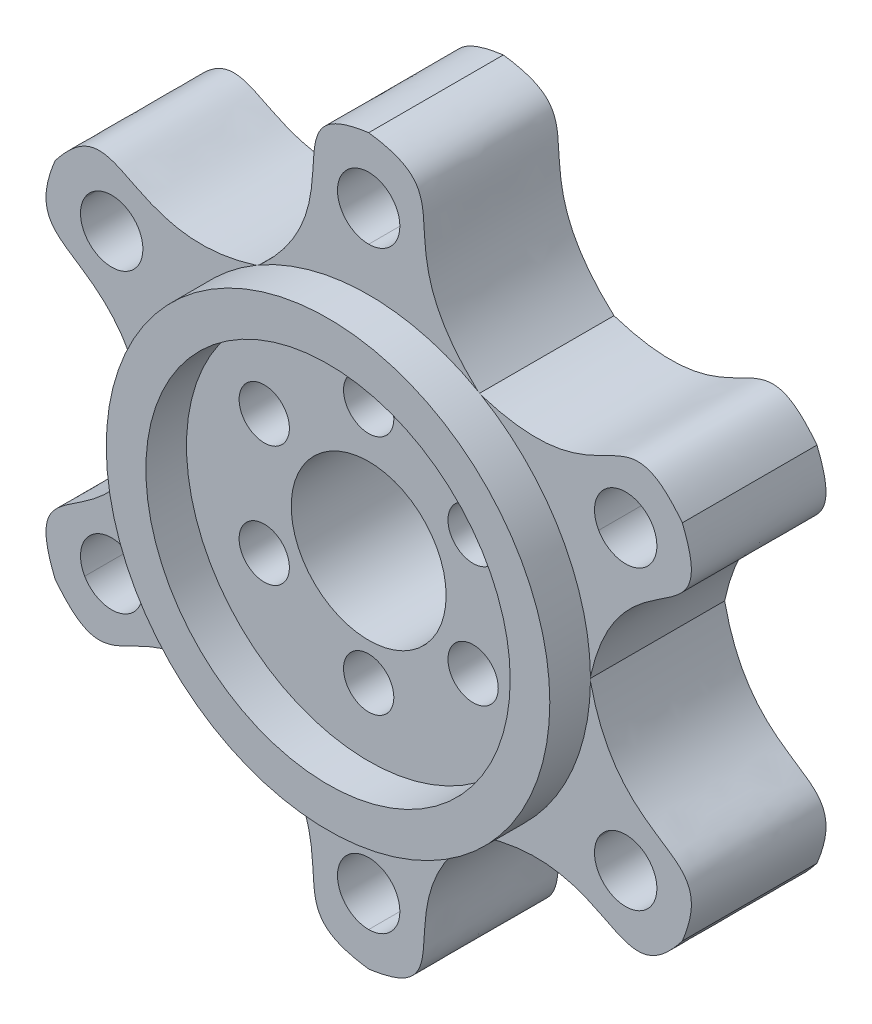
from build123d import *

# Parameters (mm, degrees)
SKETCH1_R           = 45.72
SKETCH1_R_2         = 9.779
SKETCH1_R_3         = 3.175
SKETCH1_R_4         = 3.937
BOSS_EXTRUDE3_DEPTH = 17.000000036
CUT_EXTRUDE1_START  = -22.86
CUT_EXTRUDE1_DEPTH  = 22.86
SKETCH4_R           = 28
SKETCH4_R_2         = 23
BOSS_EXTRUDE4_DEPTH = 5.1308


with BuildPart() as part:
    # Sketch1 → Boss-Extrude3 (new body)
    with BuildSketch(Plane.XY):
        Circle(SKETCH1_R)
        Circle(SKETCH1_R_2, mode=Mode.SUBTRACT)
        with Locations((0, 16.002)):
            Circle(SKETCH1_R_3, mode=Mode.SUBTRACT)
        with Locations((13.184862266, 8.389716222)):
            Circle(SKETCH1_R_3, mode=Mode.SUBTRACT)
        with Locations((13.184862266, -6.834851335)):
            Circle(SKETCH1_R_3, mode=Mode.SUBTRACT)
        with Locations((0, -14.447135113)):
            Circle(SKETCH1_R_3, mode=Mode.SUBTRACT)
        with Locations((-13.184862266, -6.834851335)):
            Circle(SKETCH1_R_3, mode=Mode.SUBTRACT)
        with Locations((-13.184862266, 8.389716222)):
            Circle(SKETCH1_R_3, mode=Mode.SUBTRACT)
        with Locations((0, 37.465)):
            Circle(SKETCH1_R_4, mode=Mode.SUBTRACT)
        with Locations((32.445641753, 18.7325)):
            Circle(SKETCH1_R_4, mode=Mode.SUBTRACT)
        with Locations((32.445641753, -18.7325)):
            Circle(SKETCH1_R_4, mode=Mode.SUBTRACT)
        with Locations((0, -37.465)):
            Circle(SKETCH1_R_4, mode=Mode.SUBTRACT)
        with Locations((-32.445641753, -18.7325)):
            Circle(SKETCH1_R_4, mode=Mode.SUBTRACT)
        with Locations((-32.445641753, 18.7325)):
            Circle(SKETCH1_R_4, mode=Mode.SUBTRACT)
    extrude(amount=BOSS_EXTRUDE3_DEPTH)

    # Sketch2 → Cut-Extrude1 (cut)
    with BuildSketch(Plane.XY.offset(17.000000036).offset(CUT_EXTRUDE1_START)):
        with BuildLine():
            ThreePointArc((39.594681461, -22.86), (45.72, 0), (39.594681461, 22.86))
            add(Edge.make_bspline(
                [(27.94, 0), (31.622092251, 17.195322725), (44.628878831, 10.61767176), (39.594681461, 22.86)],
                knots=[0, 0, 0, 0, 1, 1, 1, 1], degree=3))
            add(Edge.make_bspline(
                [(27.94, 0), (31.622092251, -17.195322725), (44.628878831, -10.61767176), (39.594681461, -22.86)],
                knots=[0, 0, 0, 0, 1, 1, 1, 1], degree=3))
        make_face()
        with BuildLine():
            add(Edge.make_bspline(
                [(13.97, 24.196749782), (30.702632431, 18.787873847), (31.509612889, 33.34090693), (39.594681461, 22.86)],
                knots=[0, 0, 0, 0, 1, 1, 1, 1], degree=3))
            ThreePointArc((39.594681461, 22.86), (22.86, 39.594681461), (0, 45.72))
            add(Edge.make_bspline(
                [(13.97, 24.196749782), (0.919459819, 35.983196572), (13.119265943, 43.95857869), (0, 45.72)],
                knots=[0, 0, 0, 0, 1, 1, 1, 1], degree=3))
        make_face()
        with BuildLine():
            ThreePointArc((0, -45.72), (22.86, -39.594681461), (39.594681461, -22.86))
            add(Edge.make_bspline(
                [(13.97, -24.196749782), (30.702632431, -18.787873847), (31.509612889, -33.34090693), (39.594681461, -22.86)],
                knots=[0, 0, 0, 0, 1, 1, 1, 1], degree=3))
            add(Edge.make_bspline(
                [(13.97, -24.196749782), (0.919459819, -35.983196572), (13.119265943, -43.95857869), (0, -45.72)],
                knots=[0, 0, 0, 0, 1, 1, 1, 1], degree=3))
        make_face()
        with BuildLine():
            add(Edge.make_bspline(
                [(-13.97, 24.196749782), (-0.919459819, 35.983196572), (-13.119265943, 43.95857869), (0, 45.72)],
                knots=[0, 0, 0, 0, 1, 1, 1, 1], degree=3))
            ThreePointArc((0, 45.72), (-22.86, 39.594681461), (-39.594681461, 22.86))
            add(Edge.make_bspline(
                [(-13.97, 24.196749782), (-30.702632431, 18.787873847), (-31.509612889, 33.34090693), (-39.594681461, 22.86)],
                knots=[0, 0, 0, 0, 1, 1, 1, 1], degree=3))
        make_face()
        with BuildLine():
            ThreePointArc((-39.594681461, -22.86), (-22.86, -39.594681461), (0, -45.72))
            add(Edge.make_bspline(
                [(-13.97, -24.196749782), (-0.919459819, -35.983196572), (-13.119265943, -43.95857869), (0, -45.72)],
                knots=[0, 0, 0, 0, 1, 1, 1, 1], degree=3))
            add(Edge.make_bspline(
                [(-13.97, -24.196749782), (-30.702632431, -18.787873847), (-31.509612889, -33.34090693), (-39.594681461, -22.86)],
                knots=[0, 0, 0, 0, 1, 1, 1, 1], degree=3))
        make_face()
        with BuildLine():
            add(Edge.make_bspline(
                [(-27.94, 0), (-31.622092251, 17.195322725), (-44.628878831, 10.61767176), (-39.594681461, 22.86)],
                knots=[0, 0, 0, 0, 1, 1, 1, 1], degree=3))
            ThreePointArc((-39.594681461, 22.86), (-45.72, 0), (-39.594681461, -22.86))
            add(Edge.make_bspline(
                [(-27.94, 0), (-31.622092251, -17.195322725), (-44.628878831, -10.61767176), (-39.594681461, -22.86)],
                knots=[0, 0, 0, 0, 1, 1, 1, 1], degree=3))
        make_face()
    extrude(amount=CUT_EXTRUDE1_DEPTH, mode=Mode.SUBTRACT)

    # Sketch4 → Boss-Extrude4 (add)
    with BuildSketch(Plane.XY.offset(17.000000036)):
        Circle(SKETCH4_R)
        Circle(SKETCH4_R_2, mode=Mode.SUBTRACT)
    extrude(amount=BOSS_EXTRUDE4_DEPTH)


solid = part.part
